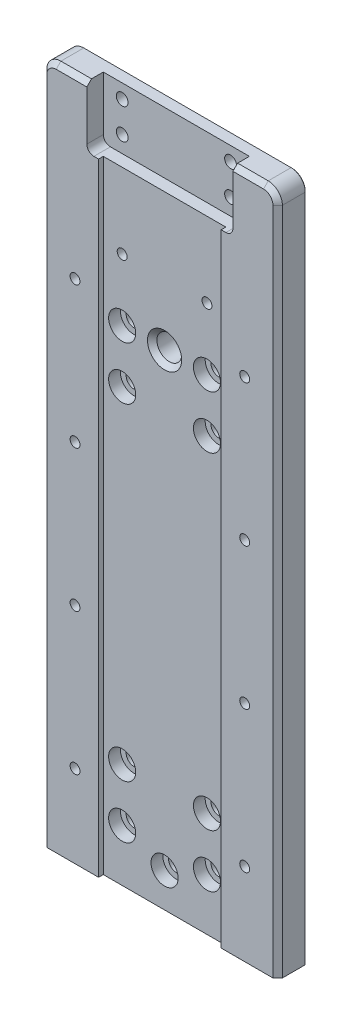
from build123d import *

# Parameters (mm, degrees)
SKETCH1_W               = 100
SKETCH1_H               = 290
BOSS_EXTRUDE1_DEPTH     = 6
SKETCH2_W               = 62
SKETCH2_H               = 26
CUT_EXTRUDE1_DEPTH      = 7
SKETCH3_W               = 52
SKETCH3_H               = 290
CUT_EXTRUDE2_DEPTH      = 2
SKETCH4_R               = 2.5
SKETCH4_R_2             = 5.25
SKETCH4_R_3             = 2.1
SKETCH4_R_4             = 3.3
CUT_EXTRUDE_HOLES_DEPTH = 21
FILLET1_R               = 3
FILLET2_R               = 6
CHAMFER1_SIZE           = 2
SKETCH5_R               = 5.75
CUT_EXTRUDE5_DEPTH      = 5
CHAMFER2_SIZE           = 2
CHAMFER3_SIZE           = 0.3


with BuildPart() as part:
    # Sketch1 → Boss-Extrude1 (new, symmetric)
    with BuildSketch(Plane.XY):
        Rectangle(SKETCH1_W, SKETCH1_H)
    extrude(amount=BOSS_EXTRUDE1_DEPTH, both=True)

    # Sketch2 → Cut-Extrude1 (cut)
    with BuildSketch(Plane.XY.offset(6)):
        with Locations((0, 132)):
            Rectangle(SKETCH2_W, SKETCH2_H)
    extrude(amount=-CUT_EXTRUDE1_DEPTH, mode=Mode.SUBTRACT)

    # Sketch3 → Cut-Extrude2 (cut)
    with BuildSketch(Plane.XY.offset(6)):
        Rectangle(SKETCH3_W, SKETCH3_H)
    extrude(amount=-CUT_EXTRUDE2_DEPTH, mode=Mode.SUBTRACT)

    # Sketch4 → Cut-Extrude HOLES (cut)
    with BuildSketch(Plane.XY.offset(-6)):
        with Locations((-23, 139)):
            Circle(SKETCH4_R)
        with Locations((23, 139)):
            Circle(SKETCH4_R)
        with Locations((23, 126)):
            Circle(SKETCH4_R)
        with Locations((-23, 126)):
            Circle(SKETCH4_R)
        with Locations((0, 60.765)):
            Circle(SKETCH4_R_2)
        with Locations((-18, 87.065)):
            Circle(SKETCH4_R_3)
        with Locations((-18, 60.765)):
            Circle(SKETCH4_R_4)
        with Locations((-18, 38.265)):
            Circle(SKETCH4_R_4)
        with Locations((-36, 70)):
            Circle(SKETCH4_R_3)
        with Locations((-36, 10)):
            Circle(SKETCH4_R_3)
        with Locations((-36, -110)):
            Circle(SKETCH4_R_3)
        with Locations((-36, -50)):
            Circle(SKETCH4_R_3)
        with Locations((-18, -100.475)):
            Circle(SKETCH4_R_4)
        with Locations((-18, -122.975)):
            Circle(SKETCH4_R_4)
        with Locations((18, -100.475)):
            Circle(SKETCH4_R_4)
        with Locations((18, -122.975)):
            Circle(SKETCH4_R_4)
        with Locations((0, -130.475)):
            Circle(SKETCH4_R_4)
        with Locations((36, 70)):
            Circle(SKETCH4_R_3)
        with Locations((18, 87.065)):
            Circle(SKETCH4_R_3)
        with Locations((18, 38.265)):
            Circle(SKETCH4_R_4)
        with Locations((18, 60.765)):
            Circle(SKETCH4_R_4)
        with Locations((36, 10)):
            Circle(SKETCH4_R_3)
        with Locations((36, -50)):
            Circle(SKETCH4_R_3)
        with Locations((36, -110)):
            Circle(SKETCH4_R_3)
    extrude(amount=CUT_EXTRUDE_HOLES_DEPTH, mode=Mode.SUBTRACT)

    # Fillet1
    fillet1_edges = [part.edges().sort_by_distance(p)[0] for p in [
        (31, 119, 2.5),
        (-31, 119, 2.5),
    ]]
    fillet(fillet1_edges, radius=FILLET1_R)

    # Fillet2
    fillet2_edges = [part.edges().sort_by_distance(p)[0] for p in [
        (50, 145, 0),
        (-50, 145, 0),
    ]]
    fillet(fillet2_edges, radius=FILLET2_R)

    # Chamfer1
    chamfer1_edges = [part.edges().sort_by_distance(p)[0] for p in [
        (50, -3, 6),
        (48.242640687, 143.242640687, 6),
        (37.5, 145, 6),
        (-50, -3, 6),
        (-48.242640687, 143.242640687, 6),
        (-37.5, 145, 6),
    ]]
    chamfer(chamfer1_edges, length=CHAMFER1_SIZE)

    # Sketch5 → Cut-Extrude5 (cut)
    with BuildSketch(Plane.XY.offset(4)):
        with Locations((-18, 60.765)):
            Circle(SKETCH5_R)
        with Locations((-18, 38.265)):
            Circle(SKETCH5_R)
        with Locations((18, 38.265)):
            Circle(SKETCH5_R)
        with Locations((18, 60.765)):
            Circle(SKETCH5_R)
        with Locations((18, -100.475)):
            Circle(SKETCH5_R)
        with Locations((-18, -100.475)):
            Circle(SKETCH5_R)
        with Locations((-18, -122.975)):
            Circle(SKETCH5_R)
        with Locations((0, -130.475)):
            Circle(SKETCH5_R)
        with Locations((18, -122.975)):
            Circle(SKETCH5_R)
    extrude(amount=-CUT_EXTRUDE5_DEPTH, mode=Mode.SUBTRACT)

    # Chamfer2
    chamfer2_edges = [part.edges().sort_by_distance(p)[0] for p in [
        (-5.25, 60.765, 4),
    ]]
    chamfer(chamfer2_edges, length=CHAMFER2_SIZE)

    # Chamfer3
    chamfer3_edges = [part.edges().sort_by_distance(p)[0] for p in [
        (-50, -3, -6),
        (-48.242640687, 143.242640687, -6),
        (48.242640687, 143.242640687, -6),
        (50, -3, -6),
        (0, 145, -6),
    ]]
    chamfer(chamfer3_edges, length=CHAMFER3_SIZE)


solid = part.part
